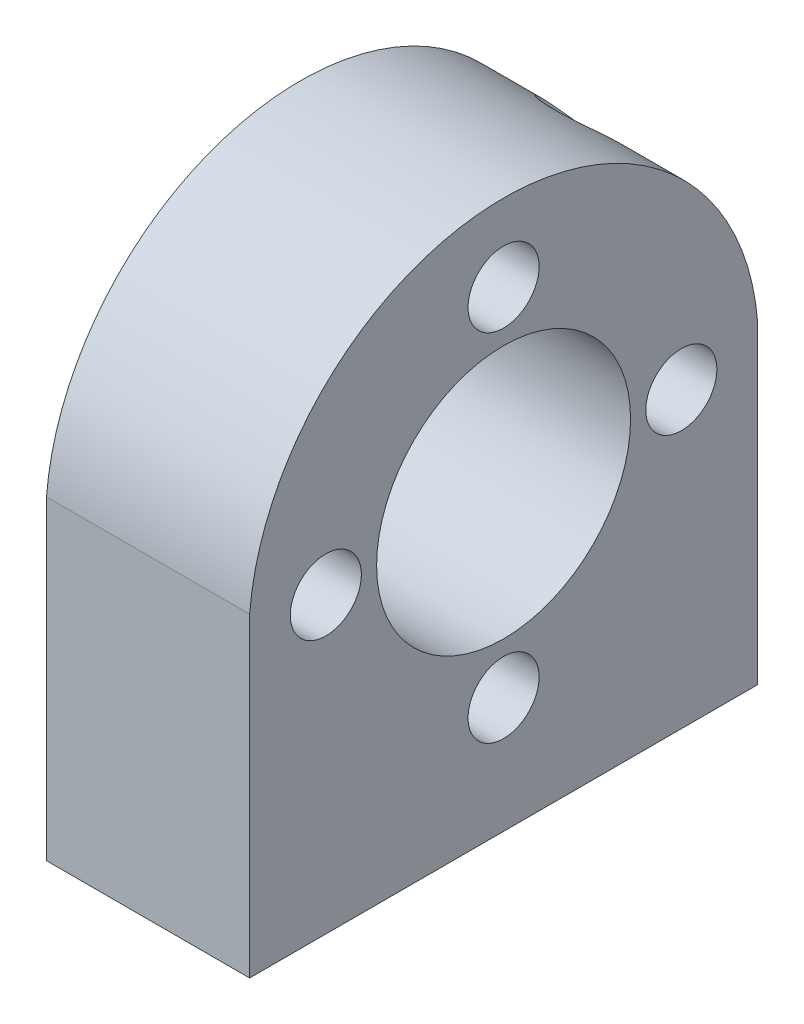
from build123d import *

# Parameters (mm, degrees)
SKIZZE1_W                       = 20
SKIZZE1_H                       = 50
AUFSATZ_LINEAR_AUSTRAGEN1_DEPTH = 54
SKIZZE2_R                       = 12.5
SKIZZE2_R_2                     = 2
SCHNITT_LINEAR_AUSTRAGEN1_DEPTH = 63.777384463
SKIZZE3_R                       = 2
SCHNITT_LINEAR_AUSTRAGEN2_DEPTH = 15
SCHNITT_LINEAR_AUSTRAGEN3_DEPTH = 63.777384463
SKIZZE5_R                       = 4
SCHNITT_LINEAR_AUSTRAGEN4_DEPTH = 18
SKIZZE6_R                       = 3.5
SCHNITT_LINEAR_AUSTRAGEN5_DEPTH = 10


with BuildPart() as part:
    # Skizze1 → Aufsatz-Linear austragen1 (new body)
    with BuildSketch(Plane(origin=(0, 0, 0), x_dir=(1, 0, 0), z_dir=(0, 1, 0))):
        Rectangle(SKIZZE1_W, SKIZZE1_H)
    extrude(amount=AUFSATZ_LINEAR_AUSTRAGEN1_DEPTH)

    # Skizze2 → Schnitt-Linear austragen1 (cut, through all)
    with BuildSketch(Plane.ZY.offset(10)):
        with Locations((0, 28.911212679)):
            Circle(SKIZZE2_R)
        with Locations((17.5, 28.911212679)):
            Circle(SKIZZE2_R_2)
        with Locations((0, 46.411212679)):
            Circle(SKIZZE2_R_2)
        with Locations((0, 11.411212679)):
            Circle(SKIZZE2_R_2)
        with Locations((-17.5, 28.911212679)):
            Circle(SKIZZE2_R_2)
    extrude(amount=-SCHNITT_LINEAR_AUSTRAGEN1_DEPTH, mode=Mode.SUBTRACT)

    # Skizze3 → Schnitt-Linear austragen2 (cut)
    with BuildSketch(Plane.XZ):
        with Locations((0, 21)):
            Circle(SKIZZE3_R)
        with Locations((0, 11)):
            Circle(SKIZZE3_R)
        with Locations((0, -11)):
            Circle(SKIZZE3_R)
        with Locations((0, -21)):
            Circle(SKIZZE3_R)
    extrude(amount=-SCHNITT_LINEAR_AUSTRAGEN2_DEPTH, mode=Mode.SUBTRACT)

    # Skizze4 → Schnitt-Linear austragen3 (cut, through all)
    with BuildSketch(Plane(origin=(10, 0, 0), x_dir=(0, 0, -1), z_dir=(1, 0, 0))):
        with BuildLine():
            Line((0, 54), (-25, 54))
            Line((-25, 54), (-25, 31.020062902))
            ThreePointArc((-25, 31.020062902), (-16.978497497, 47.382213518), (0, 54))
        make_face()
        with BuildLine():
            Line((25, 54), (0, 54))
            ThreePointArc((0, 54), (16.978497497, 47.382213518), (25, 31.020062902))
            Line((25, 31.020062902), (25, 54))
        make_face()
    extrude(amount=-SCHNITT_LINEAR_AUSTRAGEN3_DEPTH, mode=Mode.SUBTRACT)

    # Skizze5 → Schnitt-Linear austragen4 (cut)
    with BuildSketch(Plane(origin=(0, 32.196057986, -32.196057986), x_dir=(1, 0, 0), z_dir=(0, 0.7071067811865488, -0.7071067811865464))):
        with Locations((0, -20)):
            Circle(SKIZZE5_R)
    extrude(amount=-SCHNITT_LINEAR_AUSTRAGEN4_DEPTH, mode=Mode.SUBTRACT)

    # Skizze6 → Schnitt-Linear austragen5 (cut)
    with BuildSketch(Plane(origin=(10, 0, 0), x_dir=(0, 0, -1), z_dir=(1, 0, 0))):
        with Locations((17.5, 28.911212679)):
            Circle(SKIZZE6_R)
        with Locations((0, 11.411212679)):
            Circle(SKIZZE6_R)
        with Locations((-17.5, 28.911212679)):
            Circle(SKIZZE6_R)
        with Locations((0, 46.411212679)):
            Circle(SKIZZE6_R)
    extrude(amount=-SCHNITT_LINEAR_AUSTRAGEN5_DEPTH, mode=Mode.SUBTRACT)


solid = part.part
